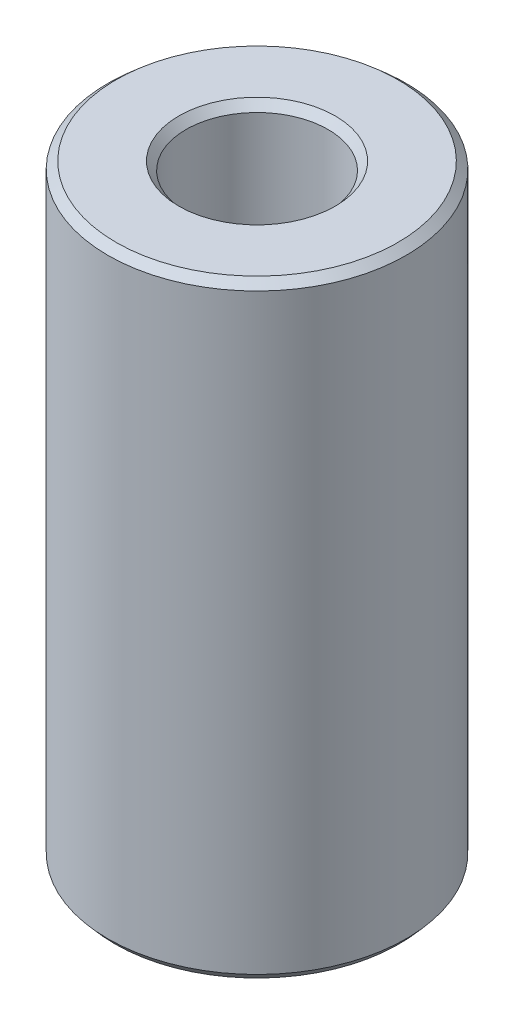
from build123d import *
from OCP.BRepFilletAPI import BRepFilletAPI_MakeChamfer

# Parameters (mm, degrees)
SKETCH1_R           = 5
BOSS_EXTRUDE1_DEPTH = 20.363080814
SKETCH2_R           = 2.383341137
CUT_EXTRUDE1_DEPTH  = 22.555859069
CHAMFER1_SIZE       = 0.239921801
CHAMFER1_SIZE2      = 0.27354025


with BuildPart() as part:
    # Sketch1 → Boss-Extrude1 (new body)
    with BuildSketch(Plane(origin=(0, 0, 0), x_dir=(1, 0, 0), z_dir=(0, 1, 0))):
        Circle(SKETCH1_R)
    extrude(amount=BOSS_EXTRUDE1_DEPTH)

    # Sketch2 → Cut-Extrude1 (cut, through all)
    with BuildSketch(Plane(origin=(0, 0, 0), x_dir=(1, 0, 0), z_dir=(0, 1, 0))):
        Circle(SKETCH2_R)
    extrude(amount=CUT_EXTRUDE1_DEPTH, mode=Mode.SUBTRACT)

    # Chamfer1: one chamfer whose edges measure the first distance from different faces: ONE call of the kernel's chamfer builder (chamfer() names one face for all edges)
    chamfer1_edges_1 = [part.edges().sort_by_distance(p)[0] for p in [
        (-2.383341137, 20.363080814, 0),
    ]]
    chamfer1_side_1 = [part.faces().sort_by_distance(p)[0] for p in [
        (-4.858578644, 20.363080814, 0),
    ]]
    chamfer1_edges_2 = [part.edges().sort_by_distance(p)[0] for p in [
        (-2.383341137, 0, 0),
    ]]
    chamfer1_side_2 = [part.faces().sort_by_distance(p)[0] for p in [
        (-2.383341137, 10.181540407, 0),
    ]]
    chamfer1_edges_3 = [part.edges().sort_by_distance(p)[0] for p in [
        (-5, 0, 0),
    ]]
    chamfer1_side_3 = [part.faces().sort_by_distance(p)[0] for p in [
        (-4.858578644, 0, 0),
    ]]
    chamfer1_edges_4 = [part.edges().sort_by_distance(p)[0] for p in [
        (-5, 20.363080814, 0),
    ]]
    chamfer1_side_4 = [part.faces().sort_by_distance(p)[0] for p in [
        (-5, 10.181540407, 0),
    ]]
    chamfer1 = BRepFilletAPI_MakeChamfer(part.part.solid().wrapped)
    for e in chamfer1_edges_1:
        chamfer1.Add(CHAMFER1_SIZE, CHAMFER1_SIZE2, e.wrapped, chamfer1_side_1[0].wrapped)  # the first distance lies on this face
    for e in chamfer1_edges_2:
        chamfer1.Add(CHAMFER1_SIZE, CHAMFER1_SIZE2, e.wrapped, chamfer1_side_2[0].wrapped)  # the first distance lies on this face
    for e in chamfer1_edges_3:
        chamfer1.Add(CHAMFER1_SIZE, CHAMFER1_SIZE2, e.wrapped, chamfer1_side_3[0].wrapped)  # the first distance lies on this face
    for e in chamfer1_edges_4:
        chamfer1.Add(CHAMFER1_SIZE, CHAMFER1_SIZE2, e.wrapped, chamfer1_side_4[0].wrapped)  # the first distance lies on this face
    add(Compound.cast(chamfer1.Shape()), mode=Mode.REPLACE)


solid = part.part
